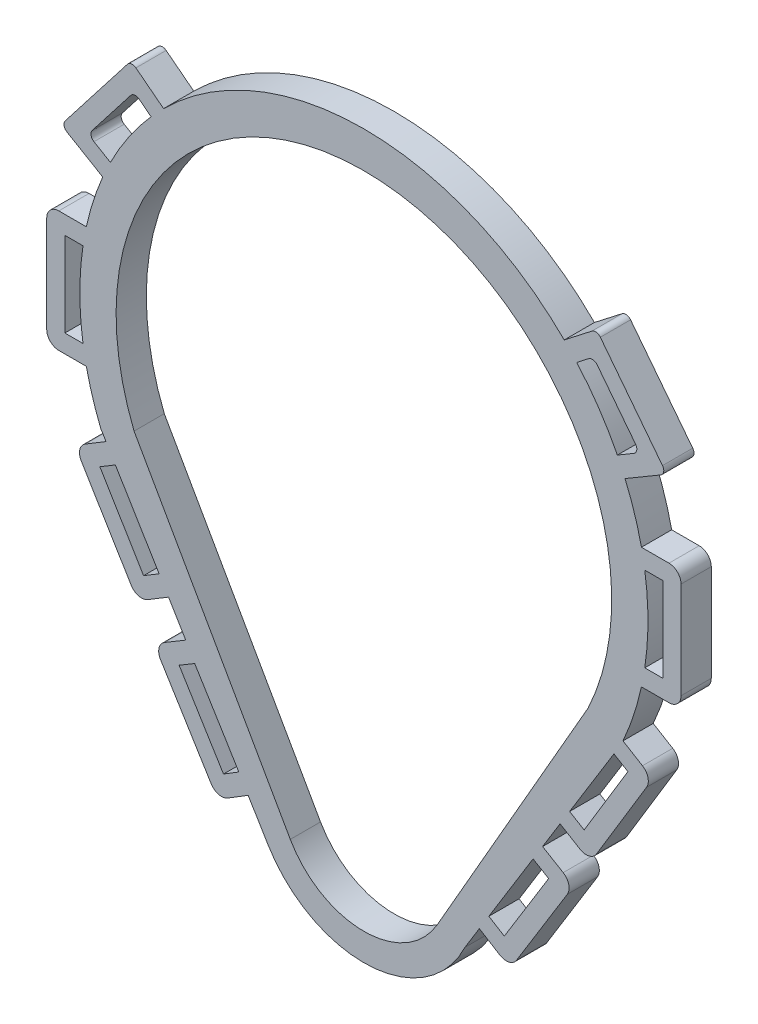
from build123d import *

# Parameters (mm, degrees)
BOSS_EXTRUDE1_DEPTH = 5
EXTRUDE_1_DEPTH     = 5
SKETCH4_W           = 3
SKETCH4_H           = 14
EXTRUDE_2_DEPTH     = 5
EXTRUDE_3_DEPTH     = 5
EXTRUDE_4_DEPTH     = 5


with BuildPart() as part:
    # Sketch1 → Boss-Extrude1 (new body)
    with BuildSketch(Plane.XY):
        with BuildLine():
            Line((-43.525507403, -17.734999444), (-15.834143063, -63.566896663))
            ThreePointArc((-15.834143063, -63.566896663), (0.921831184, -72.476899782), (16.707746892, -61.94334892))
            Line((16.707746892, -61.94334892), (42.535849019, -19.992537313))
            ThreePointArc((42.535849019, -19.992537313), (1.232467134, 46.98383791), (-43.525507403, -17.734999444))
        make_face()
        with BuildLine():
            Line((-38.025051761, -15.332822263), (-12.177775824, -60.906647231))
            ThreePointArc((-12.177775824, -60.906647231), (-0.033510124, -67.999959895), (12.144573151, -60.964864893))
            Line((12.144573151, -60.964864893), (37.105740634, -17.440298507))
            ThreePointArc((37.105740634, -17.440298507), (1.149629187, 40.983879181), (-38.025051761, -15.332822263))
        make_face(mode=Mode.SUBTRACT)
    extrude(amount=BOSS_EXTRUDE1_DEPTH)

    # Sketch3 → Extrude 1 (add)
    # profile 1 of 2: a face of its own
    with BuildSketch(Plane.XY.offset(5)):
        with BuildLine():
            Line((-31.151373165, 31.772817784), (-37.719467673, 36.870550471))
            ThreePointArc((-37.719467673, 36.870550471), (-38.45765042, 37.072720375), (-39.122580155, 36.693702059))
            Line((-39.122580155, 36.693702059), (-49.40613844, 23.444011103))
            ThreePointArc((-49.40613844, 23.444011103), (-49.59830319, 22.642754613), (-49.123651013, 21.9692232))
            Line((-49.123651013, 21.9692232), (-41.03528616, 17.205385487))
            Line((-41.03528616, 17.205385487), (-31.151373165, 31.772817784))
        make_face()
        with BuildLine():
            Line((-35.213971315, 31.128382936), (-37.188922434, 32.661213024))
            ThreePointArc((-37.188922434, 32.661213024), (-37.927105181, 32.863382927), (-38.592034917, 32.484364611))
            Line((-38.592034917, 32.484364611), (-44.945426698, 24.298435646))
            ThreePointArc((-44.945426698, 24.298435646), (-45.137591448, 23.497179157), (-44.662939271, 22.823647744))
            Line((-44.662939271, 22.823647744), (-41.937721652, 21.218565047))
            Line((-41.937721652, 21.218565047), (-35.213971315, 31.128382936))
        make_face(mode=Mode.SUBTRACT)
    # profile 2 of 2: a face of its own
    with BuildSketch(Plane.XY.offset(5)):
        with BuildLine():
            Line((31.151373165, 31.772817784), (41.03528616, 17.205385487))
            Line((41.03528616, 17.205385487), (49.123651013, 21.9692232))
            ThreePointArc((49.123651013, 21.9692232), (49.59830319, 22.642754613), (49.40613844, 23.444011103))
            Line((49.40613844, 23.444011103), (39.122580155, 36.693702059))
            ThreePointArc((39.122580155, 36.693702059), (38.45765042, 37.072720375), (37.719467673, 36.870550471))
            Line((37.719467673, 36.870550471), (31.151373165, 31.772817784))
        make_face()
        with BuildLine():
            Line((35.213971315, 31.128382936), (41.937721652, 21.218565047))
            Line((41.937721652, 21.218565047), (44.662939271, 22.823647744))
            ThreePointArc((44.662939271, 22.823647744), (45.137591448, 23.497179157), (44.945426698, 24.298435646))
            Line((44.945426698, 24.298435646), (38.592034917, 32.484364611))
            ThreePointArc((38.592034917, 32.484364611), (37.927105181, 32.863382927), (37.188922434, 32.661213024))
            Line((37.188922434, 32.661213024), (35.213971315, 31.128382936))
        make_face(mode=Mode.SUBTRACT)
    extrude(amount=-EXTRUDE_1_DEPTH)

    # Sketch4 → Extrude 2 (add)
    # profile 1 of 2: a face of its own
    with BuildSketch(Plane.XY.offset(5)):
        with BuildLine():
            Line((-43.475800154, 10), (-50.475800154, 10))
            ThreePointArc((-50.475800154, 10), (-51.890013717, 9.414213562), (-52.475800154, 8))
            Line((-52.475800154, 8), (-52.475800154, -8))
            ThreePointArc((-52.475800154, -8), (-51.890013717, -9.414213562), (-50.475800154, -10))
            Line((-50.475800154, -10), (-43.475800154, -10))
            Line((-43.475800154, -10), (-43.475800154, 10))
        make_face()
        with Locations((-47.975800154, 0)):
            Rectangle(SKETCH4_W, SKETCH4_H, mode=Mode.SUBTRACT)
    # profile 2 of 2: a face of its own
    with BuildSketch(Plane.XY.offset(5)):
        with BuildLine():
            Line((43.475800154, 10), (43.475800154, -10))
            Line((43.475800154, -10), (50.475800154, -10))
            ThreePointArc((50.475800154, -10), (51.890013717, -9.414213562), (52.475800154, -8))
            Line((52.475800154, -8), (52.475800154, 8))
            ThreePointArc((52.475800154, 8), (51.890013717, 9.414213562), (50.475800154, 10))
            Line((50.475800154, 10), (43.475800154, 10))
        make_face()
        with Locations((47.975800154, 0)):
            Rectangle(SKETCH4_W, SKETCH4_H, mode=Mode.SUBTRACT)
    extrude(amount=-EXTRUDE_2_DEPTH)

    # Sketch5 → Extrude 3 (add)
    # profile 1 of 2: a face of its own
    with BuildSketch(Plane.XY.offset(5)):
        with BuildLine():
            Line((-40.102235684, -17.599629637), (-46.093571587, -21.219559761))
            ThreePointArc((-46.093571587, -21.219559761), (-47.001074804, -22.452273702), (-46.771116095, -23.965635768))
            Line((-46.771116095, -23.965635768), (-38.496990098, -37.660117832))
            ThreePointArc((-38.496990098, -37.660117832), (-37.264276156, -38.567621049), (-35.75091409, -38.33766234))
            Line((-35.75091409, -38.33766234), (-29.759578187, -34.717732216))
            Line((-29.759578187, -34.717732216), (-40.102235684, -17.599629637))
        make_face()
        Polygon((-41.118552446, -21.718743649), (-43.686267833, -23.270142273), (-36.446407586, -35.252814078), (-33.878692199, -33.701415454), align=None, mode=Mode.SUBTRACT)
    # profile 2 of 2: a face of its own
    with BuildSketch(Plane.XY.offset(5)):
        with BuildLine():
            Line((40.102235684, -17.599629637), (29.759578187, -34.717732216))
            Line((29.759578187, -34.717732216), (35.75091409, -38.33766234))
            ThreePointArc((35.75091409, -38.33766234), (37.264276156, -38.567621049), (38.496990098, -37.660117832))
            Line((38.496990098, -37.660117832), (46.771116095, -23.965635768))
            ThreePointArc((46.771116095, -23.965635768), (47.001074804, -22.452273702), (46.093571587, -21.219559761))
            Line((46.093571587, -21.219559761), (40.102235684, -17.599629637))
        make_face()
        Polygon((41.118552446, -21.718743649), (33.878692199, -33.701415454), (36.446407586, -35.252814078), (43.686267833, -23.270142273), align=None, mode=Mode.SUBTRACT)
    extrude(amount=-EXTRUDE_3_DEPTH)

    # Sketch2 → Extrude 4 (add)
    # profile 1 of 2: a face of its own
    with BuildSketch(Plane.XY.offset(5)):
        with BuildLine():
            Line((25.26064705, -59.495829746), (33.656482222, -45.858354118))
            ThreePointArc((33.656482222, -45.858354118), (33.895637839, -44.332796696), (32.976944792, -43.091618248))
            Line((32.976944792, -43.091618248), (26.987912603, -39.523819457))
            Line((26.987912603, -39.523819457), (16.548120684, -56.480456141))
            Line((16.548120684, -56.480456141), (22.50897331, -60.150409224))
            ThreePointArc((22.50897331, -60.150409224), (24.020380217, -60.393018977), (25.26064705, -59.495829746))
        make_face()
        Polygon((27.992517968, -43.614270651), (20.675595382, -55.498645253), (23.230238175, -57.071477158), (30.569848197, -45.149643209), align=None, mode=Mode.SUBTRACT)
    # profile 2 of 2: a face of its own
    with BuildSketch(Plane.XY.offset(5)):
        with BuildLine():
            Line((-16.548120684, -56.480456141), (-22.508832972, -60.15032282))
            ThreePointArc((-22.508832972, -60.15032282), (-24.020230993, -60.392934687), (-25.260497134, -59.495758898))
            Line((-25.260497134, -59.495758898), (-33.65645672, -45.858360186))
            ThreePointArc((-33.65645672, -45.858360186), (-33.895624092, -44.332796079), (-32.976928866, -43.091608761))
            Line((-32.976928866, -43.091608761), (-26.987912603, -39.523819457))
            Line((-26.987912603, -39.523819457), (-16.548120684, -56.480456141))
        make_face()
        Polygon((-30.569848197, -45.149643209), (-27.992517968, -43.614270651), (-20.675595382, -55.498645253), (-23.230238175, -57.071477158), align=None, mode=Mode.SUBTRACT)
    extrude(amount=-EXTRUDE_4_DEPTH)


solid = part.part
